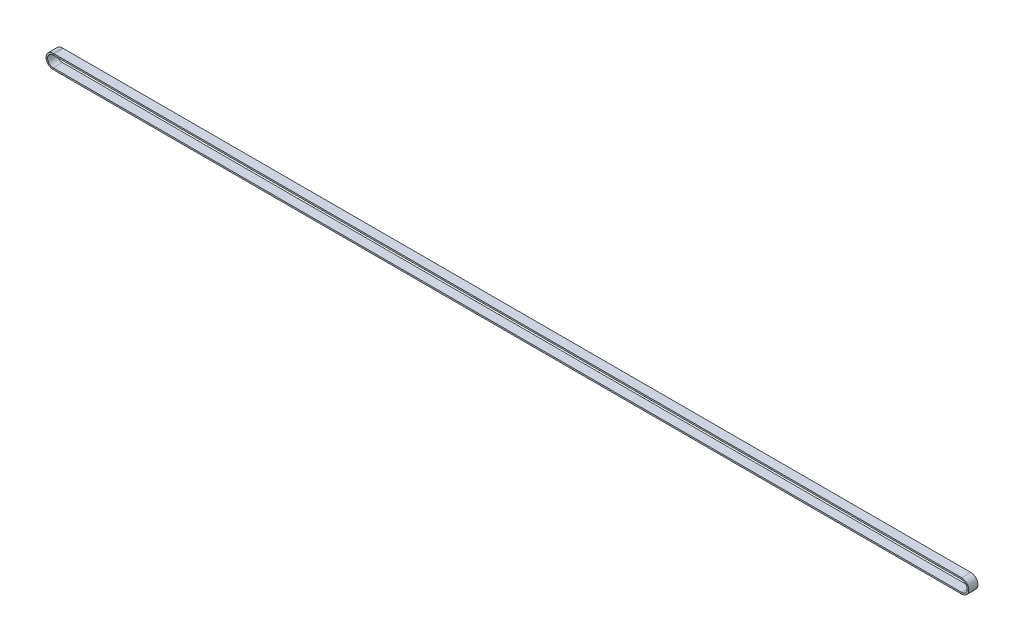
from build123d import *

# Parameters (mm, degrees)
SKETCH3_W = 9
SKETCH3_H = 1.5


with BuildPart() as part:
    # Sweep1: sweep along a path in Sketch2
    with BuildLine(Plane.XY.offset(-23.733366658)) as sweep1_path:
        Line((-1, -53.58858556), (883.520637828, -53.58858556))
        ThreePointArc((883.520637828, -53.58858556), (890.420637828, -60.48858556), (883.520637828, -67.38858556))
        Line((883.520637828, -67.38858556), (-1, -67.38858556))
        ThreePointArc((-1, -67.38858556), (-7.9, -60.48858556), (-1, -53.58858556))
    # Sketch3 → Sweep1 (sweep)
    with BuildSketch(Plane(origin=(0, 0, 0), x_dir=(0, 0, -1), z_dir=(1, 0, 0))):
        with Locations((19.233366658, -54.33858556)):
            Rectangle(SKETCH3_W, SKETCH3_H)
    sweep(path=sweep1_path.line)


solid = part.part
